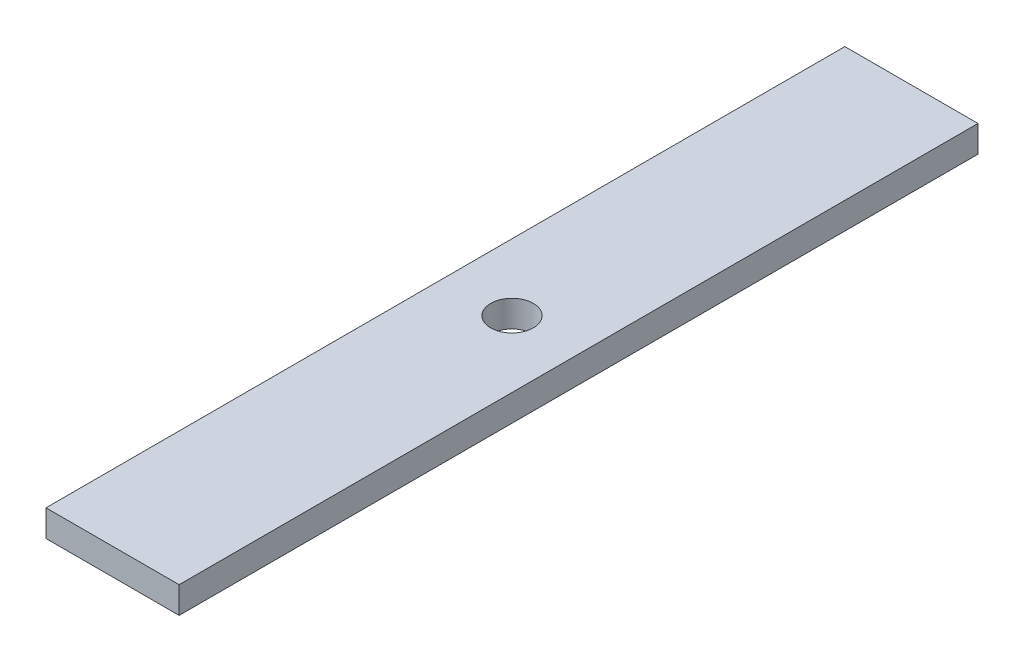
from build123d import *

# Parameters (mm, degrees)
SKETCH1_W                       = 25
SKETCH1_H                       = 5
BOSS_EXTRUDE1_DEPTH             = 106
SKETCH2_R                       = 4
HOLES_FOR_20MM_STRIP_ONLY_DEPTH = 107.851532511
SKETCH5_OUTSIDE_W               = 69.706
SKETCH5_OUTSIDE_H               = 256.706
SKETCH5_OUTSIDE_W_2             = 51.505008444
SKETCH5_OUTSIDE_H_2             = 150
CUT_EXTRUDE3_DEPTH              = 107.851532511


with BuildPart() as part:
    # Sketch1 → Boss-Extrude1 (new, symmetric)
    with BuildSketch(Plane.XY):
        Rectangle(SKETCH1_W, SKETCH1_H)
    extrude(amount=BOSS_EXTRUDE1_DEPTH, both=True)

    # Sketch2 → Holes for 20mm strip ONLY (cut, through all)
    with BuildSketch(Plane(origin=(0, 2.5, 0), x_dir=(1, 0, 0), z_dir=(0, 1, 0))):
        with Locations((0, 87.5)):
            Circle(SKETCH2_R)
        Circle(SKETCH2_R)
        with Locations((0, -87.5)):
            Circle(SKETCH2_R)
    extrude(amount=-HOLES_FOR_20MM_STRIP_ONLY_DEPTH, mode=Mode.SUBTRACT)

    # Sketch5 outside → Cut-Extrude3 (cut, through all)
    with BuildSketch(Plane(origin=(0, 2.5, 0), x_dir=(1, 0, 0), z_dir=(0, 1, 0))):
        Rectangle(SKETCH5_OUTSIDE_W, SKETCH5_OUTSIDE_H)
        Rectangle(SKETCH5_OUTSIDE_W_2, SKETCH5_OUTSIDE_H_2, mode=Mode.SUBTRACT)
    extrude(amount=-CUT_EXTRUDE3_DEPTH, mode=Mode.SUBTRACT)


solid = part.part
